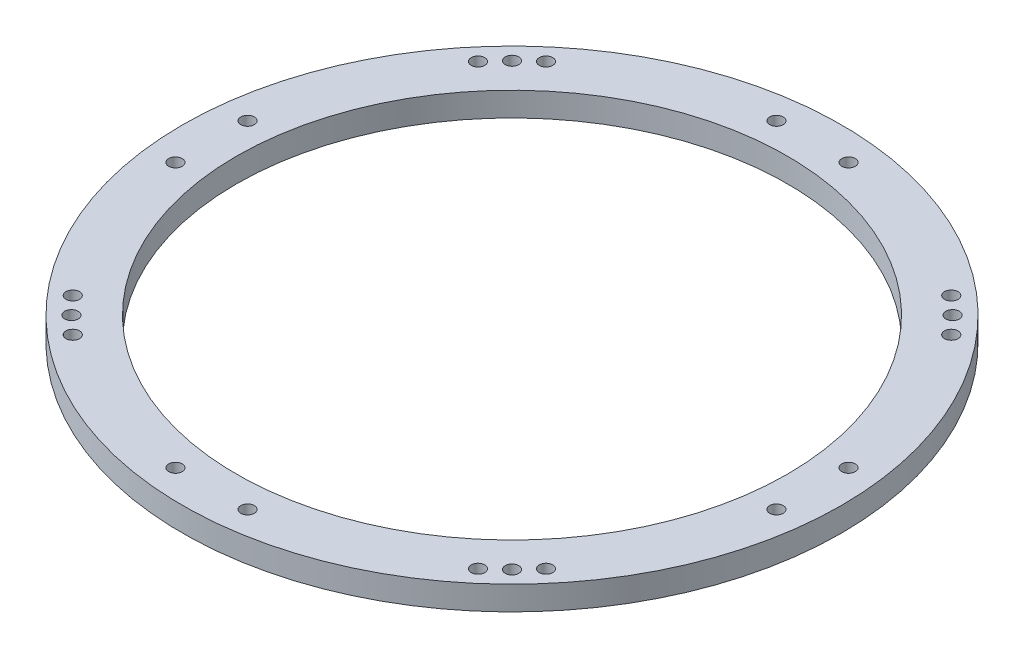
from build123d import *

# Parameters (mm, degrees)
SKETCH1_W                       = 28.575
SKETCH1_H                       = 12.7
F_9_32_0_28125_DIAMETER_HOLE1_D = 7.14375
SKETCH7_R                       = 3.571875
CUT_EXTRUDE1_DEPTH              = 247.543645639
CIRPATTERN1_COUNT               = 4


with BuildPart() as part:
    # Sketch1 → Revolve1 (revolve)
    with BuildSketch(Plane.XY):
        with Locations((159.813733777, 200.022409282)):
            Rectangle(SKETCH1_W, SKETCH1_H)
    revolve(axis=Axis((1e-09, -200000, 0), (0, 1, 0)))

    # 9/32 (0.28125) Diameter Hole1 (through all)
    with Locations(Plane(origin=(0, 206.372409282, 0), x_dir=(1, 0, 0), z_dir=(0, 1, 0))):
        with Locations((-116.372970926, 116.372970926), (-107.045703742, 125.006215984), (-125.006215984, 107.045703742)):
            f_9_32_0_28125_diameter_hole1 = Hole(F_9_32_0_28125_DIAMETER_HOLE1_D / 2)

    # Sketch7 → Cut-Extrude1 (cut, through all)
    with BuildSketch(Plane(origin=(0, 206.372409282, 0), x_dir=(1, 0, 0), z_dir=(0, 1, 0))):
        with Locations((158.75, -19.05)):
            Circle(SKETCH7_R)
        with Locations((158.75, 19.05)):
            Circle(SKETCH7_R)
    cut_extrude1 = extrude(amount=-CUT_EXTRUDE1_DEPTH, mode=Mode.SUBTRACT)

    # CirPattern1: 9/32 (0.28125) Diameter Hole1, Cut-Extrude1 ×4 about axis
    cirpattern1_axis = Axis((1e-09, -200000, 0), (0, -1, 0))
    add([f_9_32_0_28125_diameter_hole1.rotate(cirpattern1_axis, i * 360 / CIRPATTERN1_COUNT) for i in range(1, CIRPATTERN1_COUNT)], mode=Mode.SUBTRACT)
    add([cut_extrude1.rotate(cirpattern1_axis, i * 360 / CIRPATTERN1_COUNT) for i in range(1, CIRPATTERN1_COUNT)], mode=Mode.SUBTRACT)


solid = part.part
